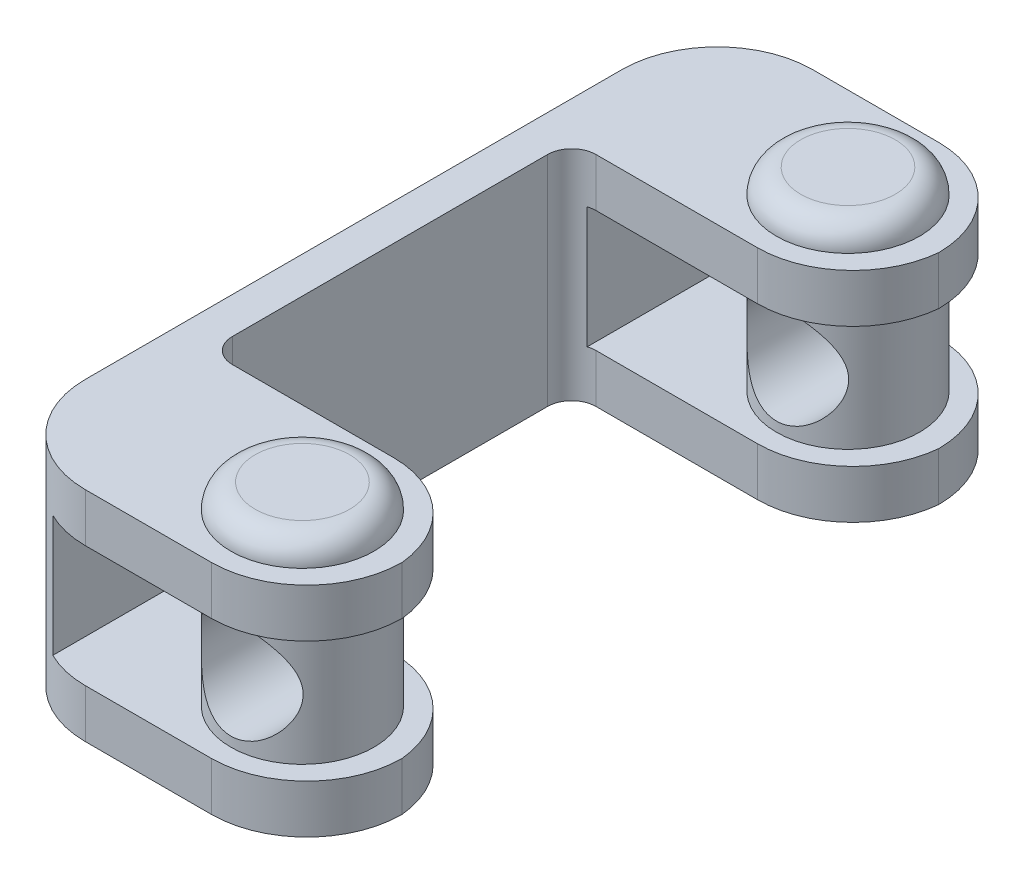
from build123d import *

# Parameters (mm, degrees)
BOSS_EXTRUDE4_DEPTH = 76.2
FILLET1_R           = 10
SKETCH8_W           = 29.387209302
SKETCH8_H           = 38.1
CUT_EXTRUDE2_DEPTH  = 25.4
FILLET2_R           = 10
SKETCH9_R           = 7.493
BOSS_EXTRUDE5_DEPTH = 2.54
FILLET4_R           = 2.54
BOSS_EXTRUDE6_REACH = 86.455
SKETCH10_R          = 7.493
SKETCH11_R          = 5.334
CUT_EXTRUDE3_DEPTH  = 76.2
FILLET5_R           = 2.54
BOSS_EXTRUDE7_DEPTH = 12.7
FILLET6_R           = 2.54
SKETCH13_R          = 4.826
CUT_EXTRUDE4_DEPTH  = 5.08


# Some blends are built 0.0001 mm under size
with BuildPart() as part:
    # Sketch7 → Boss-Extrude4 (new body)
    with BuildSketch(Plane.XY):
        Polygon((-30.221718637, -17.216733289), (2.975490665, -17.216733289), (2.975490665, -22.296733289), (-24.669160498, -22.296733289), (-24.669160498, -34.996733289), (2.975490665, -34.996733289), (2.975490665, -40.076733289), (-30.221718637, -40.076733289), (-30.221718637, -34.996733289), (-30.221718637, -22.296733289), align=None)
    extrude(amount=BOSS_EXTRUDE4_DEPTH)

    # Fillet1
    # the kernel refuses this fillet: 10 mm, written as the material it takes off along each edge
    with BuildSketch(Plane(origin=(-30.221718637, -65.076733289, 76.2), x_dir=(1, 0, 0), z_dir=(0, 1, 0)), Plane(origin=(-30.221718637, 7.783266711, 0), x_dir=(1, 0, 0), z_dir=(0, -1, 0))) as fillet1_piece_1:
        with BuildLine():
            CenterArc((FILLET1_R, FILLET1_R), FILLET1_R, 180, 90)
            Line((0, FILLET1_R), (0, 0))
            Line((0, 0), (FILLET1_R, 0))
        make_face()
    extrude(amount=72.86, mode=Mode.SUBTRACT)
    with BuildSketch(Plane(origin=(2.975490665, -9.996733289, 76.2), x_dir=(-1, 0, 0), z_dir=(0, -1, 0)), Plane(origin=(2.975490665, 7.783266711, 76.2), x_dir=(-1, 0, 0), z_dir=(0, -1, 0)), Plane(origin=(2.975490665, -9.996733289, 0), x_dir=(0, 0, 1), z_dir=(0, -1, 0))) as fillet1_piece_2:
        with BuildLine():
            CenterArc((FILLET1_R, FILLET1_R), FILLET1_R, 180, 90)
            Line((0, FILLET1_R), (0, 0))
            Line((0, 0), (FILLET1_R, 0))
        make_face()
    extrude(amount=55.08, mode=Mode.SUBTRACT)
    with BuildSketch(Plane(origin=(2.975490665, 7.783266711, 0), x_dir=(-1, 0, 0), z_dir=(0, -1, 0))) as fillet1_piece_3:
        with BuildLine():
            CenterArc((FILLET1_R, -FILLET1_R), FILLET1_R, 90, 90)
            Line((0, -FILLET1_R), (0, 0))
            Line((0, 0), (FILLET1_R, 0))
        make_face()
    extrude(amount=55.08, mode=Mode.SUBTRACT)

    # Sketch8 → Cut-Extrude2 (cut)
    with BuildSketch(Plane(origin=(0, -17.216733289, 0), x_dir=(1, 0, 0), z_dir=(0, 1, 0))):
        with Locations((-11.718113986, -38.1)):
            Rectangle(SKETCH8_W, SKETCH8_H)
    extrude(amount=-CUT_EXTRUDE2_DEPTH, mode=Mode.SUBTRACT)

    # Fillet2
    # the kernel refuses this fillet: 10 mm, written as the material it takes off along each edge
    with BuildSketch(Plane(origin=(2.975490665, -10.109801477, 57.15), x_dir=(-1, 0, 0), z_dir=(0, -1, 0)), Plane(origin=(2.975490665, 7.670198523, 57.15), x_dir=(-1, 0, 0), z_dir=(0, -1, 0))) as fillet2_piece_1:
        with BuildLine():
            CenterArc((9.954772725, -10), FILLET2_R, 90, 84.548680188)
            Line((0, -9.05), (-0.199095454, -9.031))
            ThreePointArc((-0.199095454, -9.031), (-0.2, -4.525), (-0.2, 0))
            Line((-0.2, 0), (0, 0.2))
            Line((0, 0.2), (9.954772725, 0.2))
            Line((9.954772725, 0.2), (9.954772725, 0))
        make_face()
    extrude(amount=54.853863623, mode=Mode.SUBTRACT)
    with BuildSketch(Plane(origin=(2.975490665, -10.109801477, 19.05), x_dir=(-1, 0, 0), z_dir=(0, -1, 0))) as fillet2_piece_2:
        with BuildLine():
            CenterArc((9.954772725, 10), FILLET2_R, 185.451319812, 84.548680188)
            Line((0, 9.05), (-0.199095454, 9.031))
            ThreePointArc((-0.199095454, 9.031), (-0.2, 4.525), (-0.2, 0))
            Line((-0.2, 0), (0, -0.2))
            Line((0, -0.2), (9.954772725, -0.2))
            Line((9.954772725, -0.2), (9.954772725, 0))
        make_face()
    extrude(amount=54.853863623, mode=Mode.SUBTRACT)
    with BuildSketch(Plane(origin=(2.975490665, 7.670198523, 19.05), x_dir=(0, 0, -1), z_dir=(0, -1, 0))) as fillet2_piece_3:
        with BuildLine():
            CenterArc((10, -9.954772725), FILLET2_R, 95.451319812, 84.548680188)
            Line((0, -9.954772725), (-0.2, -9.954772725))
            Line((-0.2, -9.954772725), (-0.2, 0))
            Line((-0.2, 0), (0, 0.2))
            ThreePointArc((0, 0.2), (4.525, 0.2), (9.031, 0.199095454))
            Line((9.031, 0.199095454), (9.05, 0))
        make_face()
    extrude(amount=54.853863623, mode=Mode.SUBTRACT)

    # Sketch9 → Boss-Extrude5 (add)
    with BuildSketch(Plane(origin=(0, -17.216733289, 0), x_dir=(1, 0, 0), z_dir=(0, 1, 0))):
        with Locations(Location((-7.001895697, -66.675, 0), (0, 0, 270))):
            Circle(SKETCH9_R)
        with Locations(Location((-7.001895697, -9.525, 0), (0, 0, 270))):
            Circle(SKETCH9_R)
    extrude(amount=BOSS_EXTRUDE5_DEPTH)

    # Fillet4
    fillet4_edges = [part.edges().sort_by_distance(p)[0] for p in [
        (-7.001895697, -14.676733289, 59.182),
        (-7.001895697, -14.676733289, 2.032),
    ]]
    fillet(fillet4_edges, radius=FILLET4_R - 0.0001)  # a hair under: the kernel refuses the full size

    # Sketch10 → Boss-Extrude6 (add, up to next)
    with BuildSketch(Plane(origin=(0, -34.996733289, 0), x_dir=(1, 0, 0), z_dir=(0, 1, 0)), mode=Mode.PRIVATE) as boss_extrude6_sk1:
        with Locations(Location((-7.001895697, -66.675, 0), (0, 0, 90))):
            Circle(SKETCH10_R)
    boss_extrude6_tool1 = extrude(boss_extrude6_sk1.sketch, amount=BOSS_EXTRUDE6_REACH, mode=Mode.PRIVATE) - part.part
    # Sketch10 → Boss-Extrude6 (add, up to next)
    with BuildSketch(Plane(origin=(0, -34.996733289, 0), x_dir=(1, 0, 0), z_dir=(0, 1, 0)), mode=Mode.PRIVATE) as boss_extrude6_sk2:
        with Locations(Location((-7.001895697, -9.525, 0), (0, 0, 90))):
            Circle(SKETCH10_R)
    boss_extrude6_tool2 = extrude(boss_extrude6_sk2.sketch, amount=BOSS_EXTRUDE6_REACH, mode=Mode.PRIVATE) - part.part
    add(boss_extrude6_tool1.solids().sort_by_distance((-7.001896, -34.996733, 66.675))[0])
    add(boss_extrude6_tool2.solids().sort_by_distance((-7.001896, -34.996733, 9.525))[0])

    # Sketch11 → Cut-Extrude3 (cut)
    with BuildSketch(Plane.XY.offset(76.2)):
        with Locations(Location((-7.001895697, -28.646733289, 0), (0, 0, 90.00000003))):
            Circle(SKETCH11_R)
    extrude(amount=-CUT_EXTRUDE3_DEPTH, mode=Mode.SUBTRACT)

    # Fillet5
    # the kernel refuses this fillet: 2.54 mm, written as the material it adds along each edge
    with BuildSketch(Plane(origin=(-26.411718637, -17.216733289, 57.15), x_dir=(0, 0, -1), z_dir=(0, -1, 0))) as fillet5_piece_1_section:
        with BuildLine():
            CenterArc((FILLET5_R, FILLET5_R), FILLET5_R, 180, 90)
            Line((0, FILLET5_R), (0, 0))
            Line((0, 0), (FILLET5_R, 0))
        make_face()
    fillet5_piece_1 = extrude(amount=22.86, mode=Mode.PRIVATE)
    fillet5_piece_1 = split(fillet5_piece_1, bisect_by=Plane(origin=(-24.669160498, -17.216733289, 57.15), z_dir=(-1, 0, 0)), keep=Keep.TOP, mode=Mode.PRIVATE)
    fillet5_piece_1 = split(fillet5_piece_1, bisect_by=Plane(origin=(-26.411718637, -22.296733289, 57.15), z_dir=(0, 1, 0)), keep=Keep.TOP, mode=Mode.PRIVATE)
    add(fillet5_piece_1)
    with BuildSketch(Plane(origin=(-26.411718637, -17.216733289, 57.15), x_dir=(0, 0, -1), z_dir=(0, -1, 0))) as fillet5_piece_2_section:
        with BuildLine():
            CenterArc((FILLET5_R, FILLET5_R), FILLET5_R, 180, 90)
            Line((0, FILLET5_R), (0, 0))
            Line((0, 0), (FILLET5_R, 0))
        make_face()
    fillet5_piece_2 = extrude(amount=22.86, mode=Mode.PRIVATE)
    fillet5_piece_2 = split(fillet5_piece_2, bisect_by=Plane(origin=(-24.669160498, -17.216733289, 57.15), z_dir=(1, 0, 0)), keep=Keep.TOP, mode=Mode.PRIVATE)
    fillet5_piece_2 = split(fillet5_piece_2, bisect_by=Plane(origin=(-26.411718637, -22.296733289, 57.15), z_dir=(0, 1, 0)), keep=Keep.TOP, mode=Mode.PRIVATE)
    add(fillet5_piece_2)
    with BuildSketch(Plane(origin=(-26.411718637, -17.216733289, 57.15), x_dir=(0, 0, -1), z_dir=(0, -1, 0))) as fillet5_piece_3_section:
        with BuildLine():
            CenterArc((FILLET5_R, FILLET5_R), FILLET5_R, 180, 90)
            Line((0, FILLET5_R), (0, 0))
            Line((0, 0), (FILLET5_R, 0))
        make_face()
    fillet5_piece_3 = extrude(amount=22.86, mode=Mode.PRIVATE)
    fillet5_piece_3 = split(fillet5_piece_3, bisect_by=Plane(origin=(-26.411718637, -34.996733289, 57.15), z_dir=(0, 1, 0)), keep=Keep.TOP, mode=Mode.PRIVATE)
    fillet5_piece_3 = split(fillet5_piece_3, bisect_by=Plane(origin=(-24.669160498, -17.216733289, 57.15), z_dir=(-1, 0, 0)), keep=Keep.TOP, mode=Mode.PRIVATE)
    fillet5_piece_3 = split(fillet5_piece_3, bisect_by=Plane(origin=(-26.411718637, -22.296733289, 57.15), z_dir=(0, -1, 0)), keep=Keep.TOP, mode=Mode.PRIVATE)
    add(fillet5_piece_3)
    with BuildSketch(Plane(origin=(-26.411718637, -17.216733289, 57.15), x_dir=(0, 0, -1), z_dir=(0, -1, 0))) as fillet5_piece_4_section:
        with BuildLine():
            CenterArc((FILLET5_R, FILLET5_R), FILLET5_R, 180, 90)
            Line((0, FILLET5_R), (0, 0))
            Line((0, 0), (FILLET5_R, 0))
        make_face()
    fillet5_piece_4 = extrude(amount=22.86, mode=Mode.PRIVATE)
    fillet5_piece_4 = split(fillet5_piece_4, bisect_by=Plane(origin=(-26.411718637, -34.996733289, 57.15), z_dir=(0, -1, 0)), keep=Keep.TOP, mode=Mode.PRIVATE)
    fillet5_piece_4 = split(fillet5_piece_4, bisect_by=Plane(origin=(-24.669160498, -17.216733289, 57.15), z_dir=(-1, 0, 0)), keep=Keep.TOP, mode=Mode.PRIVATE)
    add(fillet5_piece_4)
    with BuildSketch(Plane(origin=(-26.411718637, -17.216733289, 57.15), x_dir=(0, 0, -1), z_dir=(0, -1, 0))) as fillet5_piece_5_section:
        with BuildLine():
            CenterArc((FILLET5_R, FILLET5_R), FILLET5_R, 180, 90)
            Line((0, FILLET5_R), (0, 0))
            Line((0, 0), (FILLET5_R, 0))
        make_face()
    fillet5_piece_5 = extrude(amount=22.86, mode=Mode.PRIVATE)
    fillet5_piece_5 = split(fillet5_piece_5, bisect_by=Plane(origin=(-26.411718637, -34.996733289, 57.15), z_dir=(0, -1, 0)), keep=Keep.TOP, mode=Mode.PRIVATE)
    fillet5_piece_5 = split(fillet5_piece_5, bisect_by=Plane(origin=(-24.669160498, -17.216733289, 57.15), z_dir=(1, 0, 0)), keep=Keep.TOP, mode=Mode.PRIVATE)
    add(fillet5_piece_5)
    with BuildSketch(Plane(origin=(-26.411718637, -17.216733289, 19.05), x_dir=(1, 0, 0), z_dir=(0, -1, 0))) as fillet5_piece_6_section:
        with BuildLine():
            CenterArc((FILLET5_R, FILLET5_R), FILLET5_R, 180, 90)
            Line((0, FILLET5_R), (0, 0))
            Line((0, 0), (FILLET5_R, 0))
        make_face()
    fillet5_piece_6 = extrude(amount=22.86, mode=Mode.PRIVATE)
    fillet5_piece_6 = split(fillet5_piece_6, bisect_by=Plane(origin=(-26.411718637, -22.296733289, 19.05), z_dir=(0, 1, 0)), keep=Keep.TOP, mode=Mode.PRIVATE)
    fillet5_piece_6 = split(fillet5_piece_6, bisect_by=Plane(origin=(-24.669160498, -17.216733289, 19.05), z_dir=(1, 0, 0)), keep=Keep.TOP, mode=Mode.PRIVATE)
    add(fillet5_piece_6)
    with BuildSketch(Plane(origin=(-26.411718637, -17.216733289, 19.05), x_dir=(1, 0, 0), z_dir=(0, -1, 0))) as fillet5_piece_7_section:
        with BuildLine():
            CenterArc((FILLET5_R, FILLET5_R), FILLET5_R, 180, 90)
            Line((0, FILLET5_R), (0, 0))
            Line((0, 0), (FILLET5_R, 0))
        make_face()
    fillet5_piece_7 = extrude(amount=22.86, mode=Mode.PRIVATE)
    fillet5_piece_7 = split(fillet5_piece_7, bisect_by=Plane(origin=(-26.411718637, -22.296733289, 19.05), z_dir=(0, 1, 0)), keep=Keep.TOP, mode=Mode.PRIVATE)
    fillet5_piece_7 = split(fillet5_piece_7, bisect_by=Plane(origin=(-24.669160498, -17.216733289, 19.05), z_dir=(-1, 0, 0)), keep=Keep.TOP, mode=Mode.PRIVATE)
    add(fillet5_piece_7)
    with BuildSketch(Plane(origin=(-26.411718637, -17.216733289, 19.05), x_dir=(1, 0, 0), z_dir=(0, -1, 0))) as fillet5_piece_8_section:
        with BuildLine():
            CenterArc((FILLET5_R, FILLET5_R), FILLET5_R, 180, 90)
            Line((0, FILLET5_R), (0, 0))
            Line((0, 0), (FILLET5_R, 0))
        make_face()
    fillet5_piece_8 = extrude(amount=22.86, mode=Mode.PRIVATE)
    fillet5_piece_8 = split(fillet5_piece_8, bisect_by=Plane(origin=(-26.411718637, -22.296733289, 19.05), z_dir=(0, -1, 0)), keep=Keep.TOP, mode=Mode.PRIVATE)
    fillet5_piece_8 = split(fillet5_piece_8, bisect_by=Plane(origin=(-24.669160498, -17.216733289, 19.05), z_dir=(-1, 0, 0)), keep=Keep.TOP, mode=Mode.PRIVATE)
    fillet5_piece_8 = split(fillet5_piece_8, bisect_by=Plane(origin=(-26.411718637, -34.996733289, 19.05), z_dir=(0, 1, 0)), keep=Keep.TOP, mode=Mode.PRIVATE)
    add(fillet5_piece_8)
    with BuildSketch(Plane(origin=(-26.411718637, -17.216733289, 19.05), x_dir=(1, 0, 0), z_dir=(0, -1, 0))) as fillet5_piece_9_section:
        with BuildLine():
            CenterArc((FILLET5_R, FILLET5_R), FILLET5_R, 180, 90)
            Line((0, FILLET5_R), (0, 0))
            Line((0, 0), (FILLET5_R, 0))
        make_face()
    fillet5_piece_9 = extrude(amount=22.86, mode=Mode.PRIVATE)
    fillet5_piece_9 = split(fillet5_piece_9, bisect_by=Plane(origin=(-24.669160498, -17.216733289, 19.05), z_dir=(1, 0, 0)), keep=Keep.TOP, mode=Mode.PRIVATE)
    fillet5_piece_9 = split(fillet5_piece_9, bisect_by=Plane(origin=(-26.411718637, -34.996733289, 19.05), z_dir=(0, -1, 0)), keep=Keep.TOP, mode=Mode.PRIVATE)
    add(fillet5_piece_9)
    with BuildSketch(Plane(origin=(-26.411718637, -17.216733289, 19.05), x_dir=(1, 0, 0), z_dir=(0, -1, 0))) as fillet5_piece_10_section:
        with BuildLine():
            CenterArc((FILLET5_R, FILLET5_R), FILLET5_R, 180, 90)
            Line((0, FILLET5_R), (0, 0))
            Line((0, 0), (FILLET5_R, 0))
        make_face()
    fillet5_piece_10 = extrude(amount=22.86, mode=Mode.PRIVATE)
    fillet5_piece_10 = split(fillet5_piece_10, bisect_by=Plane(origin=(-24.669160498, -17.216733289, 19.05), z_dir=(-1, 0, 0)), keep=Keep.TOP, mode=Mode.PRIVATE)
    fillet5_piece_10 = split(fillet5_piece_10, bisect_by=Plane(origin=(-26.411718637, -34.996733289, 19.05), z_dir=(0, -1, 0)), keep=Keep.TOP, mode=Mode.PRIVATE)
    add(fillet5_piece_10)

    # Sketch12 → Boss-Extrude7 (add)
    with BuildSketch(Plane.ZY.offset(30.221718637)):
        Polygon((29.21, -40.076733289), (38.1, -40.076733289), (46.99, -40.076733289), (46.99, -36.266733289), (38.1, -36.266733289), (29.21, -36.266733289), align=None)
    extrude(amount=BOSS_EXTRUDE7_DEPTH)

    # Fillet6
    fillet6_edges = [part.edges().sort_by_distance(p)[0] for p in [
        (-42.921718637, -38.171733289, 46.99),
        (-42.921718637, -38.171733289, 29.21),
    ]]
    fillet(fillet6_edges, radius=FILLET6_R)

    # Sketch13 → Cut-Extrude4 (cut)
    with BuildSketch(Plane(origin=(0, -36.266733289, 0), x_dir=(1, 0, 0), z_dir=(0, 1, 0))):
        with Locations(Location((-36.571718637, -38.1, 0), (0, 0, 270))):
            Circle(SKETCH13_R)
    extrude(amount=-CUT_EXTRUDE4_DEPTH, mode=Mode.SUBTRACT)


solid = part.part
